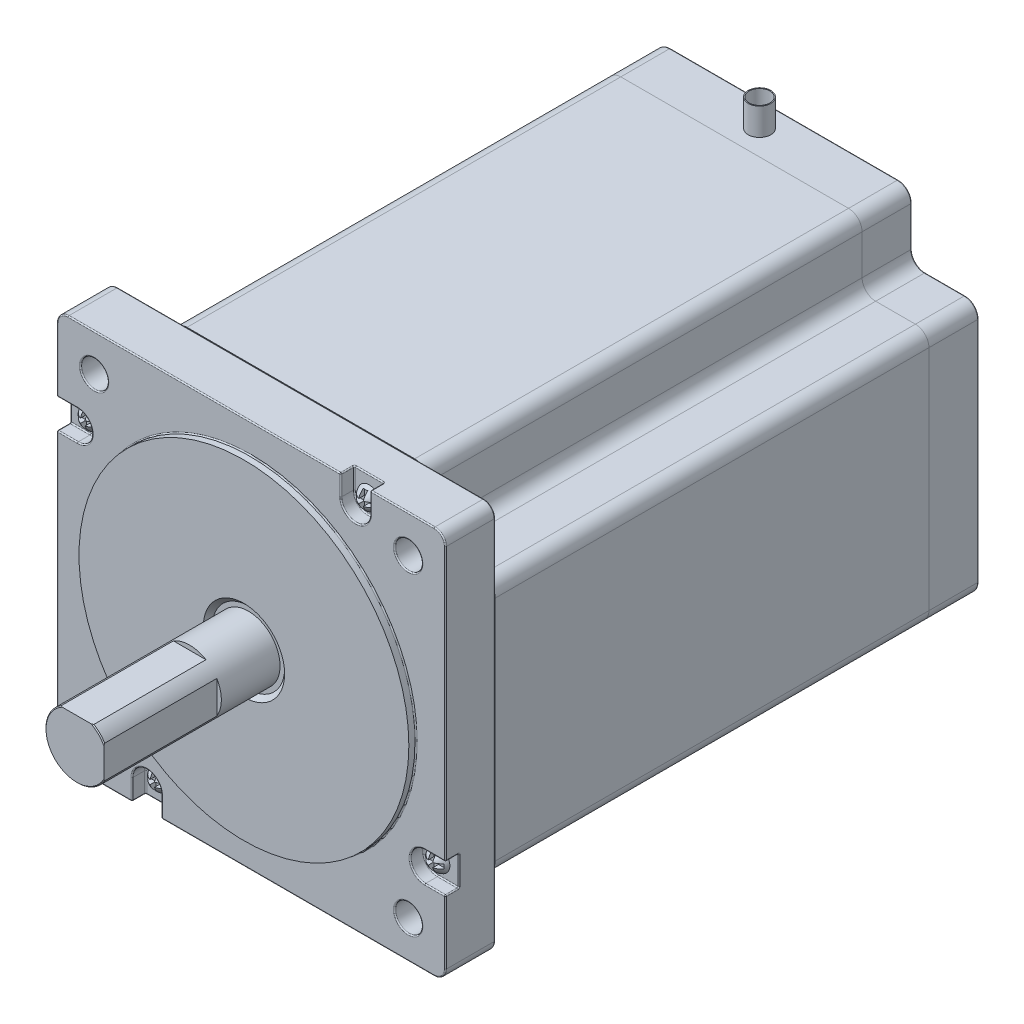
from build123d import *

# Parameters (mm, degrees)
SKETCH1_R                = 1.25
BOSS_EXTRUDE1_DEPTH      = 48
FILLET1_R                = 3
SKETCH2_R                = 1.25
BOSS_EXTRUDE2_DEPTH      = 11
SKETCH4_W                = 86
SKETCH4_H                = 86
SKETCH4_R                = 1.25
BOSS_EXTRUDE3_DEPTH      = 11
FILLET2_R                = 2.5
CUT_EXTRUDE1_DEPTH       = 3
SKETCH6_R                = 3
CUT_EXTRUDE2_DEPTH       = 11
SKETCH7_R                = 36.5
BOSS_EXTRUDE4_DEPTH      = 1.6
SKETCH8_R                = 8
CUT_EXTRUDE3_DEPTH       = 135.172128253
CHAMFER1_SIZE            = 1
CHAMFER2_SIZE            = 1
SKETCH9_R                = 8
SKETCH9_R_2              = 7
BOSS_EXTRUDE5_DEPTH      = 57.5
BOSS_EXTRUDE6_DEPTH      = 17.6
BOSS_EXTRUDE6_DEPTH_BACK = 124
SKETCH10_R               = 7
CHAMFER4_SIZE            = 0.2
CHAMFER5_SIZE            = 0.2
FILLET3_R                = 0.25
FILLET4_R                = 0.25
FILLET5_R                = 0.25
FILLET6_R                = 0.25
SKETCH18_R               = 2.5
SKETCH18_R_2             = 2.3
BOSS_EXTRUDE8_DEPTH      = 6
SKETCH24_W               = 24.354002436
SKETCH24_H               = 8.172852169
SKETCH24_W_2             = 4.223554476
SKETCH24_H_2             = 10.202352371
CUT_EXTRUDE4_DEPTH       = 25
CUT_EXTRUDE5_DEPTH       = 2.5
CIRPATTERN1_COUNT        = 4


with BuildPart() as part:
    # Sketch1 → Boss-Extrude1 (new, symmetric)
    with BuildSketch(Plane.XY):
        Polygon((-43, 28.2), (-28.2, 28.2), (-28.2, 43), (28.2, 43), (28.2, 28.2), (43, 28.2), (43, -28.2), (28.2, -28.2), (28.2, -43), (-28.2, -43), (-28.2, -28.2), (-43, -28.2), align=None)
        with Locations((-38.44, 23.1)):
            Circle(SKETCH1_R, mode=Mode.SUBTRACT)
        with Locations((23.1, 38.44)):
            Circle(SKETCH1_R, mode=Mode.SUBTRACT)
        with Locations((38.44, -23.1)):
            Circle(SKETCH1_R, mode=Mode.SUBTRACT)
        with Locations((-23.1, -38.44)):
            Circle(SKETCH1_R, mode=Mode.SUBTRACT)
    extrude(amount=BOSS_EXTRUDE1_DEPTH, both=True)

    # Fillet1
    fillet1_edges = [part.edges().sort_by_distance(p)[0] for p in [
        (-43, 28.2, 0),
        (-28.2, 28.2, 0),
        (-28.2, 43, 0),
        (28.2, 43, 0),
        (28.2, 28.2, 0),
        (43, 28.2, 0),
        (43, -28.2, 0),
        (28.2, -28.2, 0),
        (28.2, -43, 0),
        (-28.2, -43, 0),
        (-28.2, -28.2, 0),
        (-43, -28.2, 0),
    ]]
    fillet(fillet1_edges, radius=FILLET1_R)


with BuildPart() as body_2:
    # Sketch2 → Boss-Extrude2 (new body)
    with BuildSketch(Plane(origin=(0, 0, -48), x_dir=(-1, 0, 0), z_dir=(0, 0, -1))):
        with BuildLine():
            Line((-43, 25.2), (-43, -25.2))
            ThreePointArc((-43, -25.2), (-42.121320344, -27.321320344), (-40, -28.2))
            Line((-40, -28.2), (-31.2, -28.2))
            ThreePointArc((-31.2, -28.2), (-29.078679656, -29.078679656), (-28.2, -31.2))
            Line((-28.2, -31.2), (-28.2, -40))
            ThreePointArc((-28.2, -40), (-27.321320344, -42.121320344), (-25.2, -43))
            Line((-25.2, -43), (25.2, -43))
            ThreePointArc((25.2, -43), (27.321320344, -42.121320344), (28.2, -40))
            Line((28.2, -40), (28.2, -31.2))
            ThreePointArc((28.2, -31.2), (29.078679656, -29.078679656), (31.2, -28.2))
            Line((31.2, -28.2), (40, -28.2))
            ThreePointArc((40, -28.2), (42.121320344, -27.321320344), (43, -25.2))
            Line((43, -25.2), (43, 25.2))
            ThreePointArc((43, 25.2), (42.121320344, 27.321320344), (40, 28.2))
            Line((40, 28.2), (31.2, 28.2))
            ThreePointArc((31.2, 28.2), (29.078679656, 29.078679656), (28.2, 31.2))
            Line((28.2, 31.2), (28.2, 40))
            ThreePointArc((28.2, 40), (27.321320344, 42.121320344), (25.2, 43))
            Line((25.2, 43), (-25.2, 43))
            ThreePointArc((-25.2, 43), (-27.321320344, 42.121320344), (-28.2, 40))
            Line((-28.2, 40), (-28.2, 31.2))
            ThreePointArc((-28.2, 31.2), (-29.078679656, 29.078679656), (-31.2, 28.2))
            Line((-31.2, 28.2), (-40, 28.2))
            ThreePointArc((-40, 28.2), (-42.121320344, 27.321320344), (-43, 25.2))
        make_face()
        with Locations((38.44, 23.1)):
            Circle(SKETCH2_R, mode=Mode.SUBTRACT)
        with Locations((23.1, -38.44)):
            Circle(SKETCH2_R, mode=Mode.SUBTRACT)
        with Locations((-38.44, -23.1)):
            Circle(SKETCH2_R, mode=Mode.SUBTRACT)
        with Locations((-23.1, 38.44)):
            Circle(SKETCH2_R, mode=Mode.SUBTRACT)
    extrude(amount=BOSS_EXTRUDE2_DEPTH)


with BuildPart() as body_3:
    # Sketch4 → Boss-Extrude3 (new body)
    with BuildSketch(Plane.XY.offset(48)):
        Rectangle(SKETCH4_W, SKETCH4_H)
        with Locations((-23.1, -38.44)):
            Circle(SKETCH4_R, mode=Mode.SUBTRACT)
        with Locations((38.44, -23.1)):
            Circle(SKETCH4_R, mode=Mode.SUBTRACT)
        with Locations((23.1, 38.44)):
            Circle(SKETCH4_R, mode=Mode.SUBTRACT)
        with Locations((-38.44, 23.1)):
            Circle(SKETCH4_R, mode=Mode.SUBTRACT)
    extrude(amount=BOSS_EXTRUDE3_DEPTH)

    # Fillet2
    fillet2_edges = [body_3.edges().sort_by_distance(p)[0] for p in [
        (43, -43, 53.5),
        (-43, -43, 53.5),
        (-43, 43, 53.5),
        (43, 43, 53.5),
    ]]
    fillet(fillet2_edges, radius=FILLET2_R)

    # Sketch5 → Cut-Extrude1 (cut)
    with BuildSketch(Plane.XY.offset(59)):
        with BuildLine():
            Line((-38.44, 26.35), (-43, 26.35))
            Line((-43, 26.35), (-43, 19.85))
            Line((-43, 19.85), (-38.44, 19.85))
            ThreePointArc((-38.44, 19.85), (-35.19, 23.1), (-38.44, 26.35))
        make_face()
        with BuildLine():
            Line((26.35, 38.44), (26.35, 43))
            Line((26.35, 43), (19.85, 43))
            Line((19.85, 43), (19.85, 38.44))
            ThreePointArc((19.85, 38.44), (23.1, 35.19), (26.35, 38.44))
        make_face()
        with BuildLine():
            Line((38.44, -26.35), (43, -26.35))
            Line((43, -26.35), (43, -19.85))
            Line((43, -19.85), (38.44, -19.85))
            ThreePointArc((38.44, -19.85), (35.19, -23.1), (38.44, -26.35))
        make_face()
        with BuildLine():
            Line((-26.35, -38.44), (-26.35, -43))
            Line((-26.35, -43), (-19.85, -43))
            Line((-19.85, -43), (-19.85, -38.44))
            ThreePointArc((-19.85, -38.44), (-23.1, -35.19), (-26.35, -38.44))
        make_face()
    extrude(amount=-CUT_EXTRUDE1_DEPTH, mode=Mode.SUBTRACT)

    # Sketch6 → Cut-Extrude2 (cut)
    with BuildSketch(Plane.XY.offset(59)):
        with Locations((-34.75, 34.75)):
            Circle(SKETCH6_R)
        with Locations((34.75, 34.75)):
            Circle(SKETCH6_R)
        with Locations((34.75, -34.75)):
            Circle(SKETCH6_R)
        with Locations((-34.75, -34.75)):
            Circle(SKETCH6_R)
    extrude(amount=-CUT_EXTRUDE2_DEPTH, mode=Mode.SUBTRACT)

    # Sketch7 → Boss-Extrude4 (add)
    with BuildSketch(Plane.XY.offset(59)):
        Circle(SKETCH7_R)
    extrude(amount=BOSS_EXTRUDE4_DEPTH)


with BuildPart() as cut_extrude3_tool:
    # Sketch8 → Cut-Extrude3 (new, through all)
    with BuildSketch(Plane.XY.offset(60.6)):
        Circle(SKETCH8_R)
    extrude(amount=-CUT_EXTRUDE3_DEPTH)


with BuildPart() as part_1:
    add(part.part)

    # Cut-Extrude3: cut by cut_extrude3_tool
    add(cut_extrude3_tool.part, mode=Mode.SUBTRACT)


with BuildPart() as body_2_1:
    add(body_2.part)

    # Cut-Extrude3: cut by cut_extrude3_tool
    add(cut_extrude3_tool.part, mode=Mode.SUBTRACT)

    # Chamfer1
    chamfer1_edges = [body_2_1.edges().sort_by_distance(p)[0] for p in [
        (-8, 0, -59),
    ]]
    chamfer(chamfer1_edges, length=CHAMFER1_SIZE)

    # Fillet5
    fillet5_edges = [body_2_1.edges().sort_by_distance(p)[0] for p in [
        (42.121320344, -27.321320344, -59),
        (35.6, -28.2, -59),
        (29.078679656, -29.078679656, -59),
        (28.2, -35.6, -59),
        (27.321320344, -42.121320344, -59),
        (0, -43, -59),
        (-27.321320344, -42.121320344, -59),
        (-28.2, -35.6, -59),
        (-29.078679656, -29.078679656, -59),
        (-35.6, -28.2, -59),
        (42.121320344, 27.321320344, -59),
        (-42.121320344, -27.321320344, -59),
        (-43, 0, -59),
        (-42.121320344, 27.321320344, -59),
        (-35.6, 28.2, -59),
        (-29.078679656, 29.078679656, -59),
        (-28.2, 35.6, -59),
        (-37.19, 23.1, -59),
        (-27.321320344, 42.121320344, -59),
        (-21.85, -38.44, -59),
        (0, 43, -59),
        (39.69, -23.1, -59),
        (27.321320344, 42.121320344, -59),
        (28.2, 35.6, -59),
        (24.35, 38.44, -59),
        (43, 0, -59),
        (29.078679656, 29.078679656, -59),
        (35.6, 28.2, -59),
        (-9, 0, -59),
    ]]
    fillet(fillet5_edges, radius=FILLET5_R)


with BuildPart() as body_3_1:
    add(body_3.part)

    # Cut-Extrude3: cut by cut_extrude3_tool
    add(cut_extrude3_tool.part, mode=Mode.SUBTRACT)

    # Chamfer2
    chamfer2_edges = [body_3_1.edges().sort_by_distance(p)[0] for p in [
        (-8, 0, 60.6),
    ]]
    chamfer(chamfer2_edges, length=CHAMFER2_SIZE)

    # Fillet3
    fillet3_edges = [body_3_1.edges().sort_by_distance(p)[0] for p in [
        (-37.75, 34.75, 59),
        (31.75, 34.75, 59),
        (31.75, -34.75, 59),
        (-37.75, -34.75, 59),
        (-36.5, 0, 59),
        (-33.425, -43, 59),
        (-43, 33.425, 59),
        (43, -33.425, 59),
        (33.425, 43, 59),
        (-42.267766953, 42.267766953, 59),
        (42.267766953, 42.267766953, 59),
        (42.267766953, -42.267766953, 59),
        (-42.267766953, -42.267766953, 59),
        (-43, -10.325, 59),
        (-35.19, 23.1, 59),
        (-40.72, 26.35, 59),
        (-40.72, 19.85, 59),
        (10.325, -43, 59),
        (-10.325, 43, 59),
        (43, 10.325, 59),
        (23.1, 35.19, 59),
        (26.35, 40.72, 59),
        (19.85, 40.72, 59),
        (35.19, -23.1, 59),
        (40.72, -26.35, 59),
        (40.72, -19.85, 59),
        (-23.1, -35.19, 59),
        (-26.35, -40.72, 59),
        (-19.85, -40.72, 59),
    ]]
    fillet(fillet3_edges, radius=FILLET3_R)

    # Fillet4
    # the kernel refuses this fillet: 0.25 mm, written as the material it adds along each edge
    with BuildSketch(Plane(origin=(-38.44, 23.1, 56), x_dir=(0, -1, 0), z_dir=(-1, 0, 0))) as fillet4_piece_1:
        with BuildLine():
            CenterArc((3.25 - FILLET4_R, FILLET4_R), FILLET4_R, 270, 90)
            Line((3.25, FILLET4_R), (3.25, 0))
            Line((3.25, 0), (3.25 - FILLET4_R, 0))
        make_face()
    revolve(axis=Axis((-38.44, 23.1, 56), (0, 0, 1)), revolution_arc=180)
    with BuildSketch(Plane(origin=(-43, 19.85, 56), x_dir=(0, 1, 0), z_dir=(1, 0, 0)), Plane(origin=(19.85, 43, 56), x_dir=(1, 0, 0), z_dir=(0, -1, 0)), Plane(origin=(43, -19.85, 56), x_dir=(0, -1, 0), z_dir=(-1, 0, 0)), Plane(origin=(-19.85, -43, 56), x_dir=(-1, 0, 0), z_dir=(0, 1, 0))) as fillet4_piece_2:
        with BuildLine():
            CenterArc((FILLET4_R, FILLET4_R), FILLET4_R, 180, 90)
            Line((0, FILLET4_R), (0, 0))
            Line((0, 0), (FILLET4_R, 0))
        make_face()
    extrude(amount=4.56)
    with BuildSketch(Plane(origin=(-38.44, 26.35, 56), x_dir=(0, 0, 1), z_dir=(-1, 0, 0)), Plane(origin=(26.35, 38.44, 56), x_dir=(0, 0, 1), z_dir=(0, 1, 0)), Plane(origin=(38.44, -26.35, 56), x_dir=(0, 0, 1), z_dir=(1, 0, 0)), Plane(origin=(-26.35, -38.44, 56), x_dir=(0, 0, 1), z_dir=(0, -1, 0))) as fillet4_piece_3:
        with BuildLine():
            CenterArc((FILLET4_R, -FILLET4_R), FILLET4_R, 90, 90)
            Line((0, -FILLET4_R), (0, 0))
            Line((0, 0), (FILLET4_R, 0))
        make_face()
    extrude(amount=4.56)
    with BuildSketch(Plane(origin=(23.1, 38.44, 56), x_dir=(-1, 0, 0), z_dir=(0, 1, 0))) as fillet4_piece_4:
        with BuildLine():
            CenterArc((3.25 - FILLET4_R, FILLET4_R), FILLET4_R, 270, 90)
            Line((3.25, FILLET4_R), (3.25, 0))
            Line((3.25, 0), (3.25 - FILLET4_R, 0))
        make_face()
    revolve(axis=Axis((23.1, 38.44, 56), (0, 0, 1)), revolution_arc=180)
    with BuildSketch(Plane(origin=(38.44, -23.1, 56), x_dir=(0, 1, 0), z_dir=(1, 0, 0))) as fillet4_piece_5:
        with BuildLine():
            CenterArc((3.25 - FILLET4_R, FILLET4_R), FILLET4_R, 270, 90)
            Line((3.25, FILLET4_R), (3.25, 0))
            Line((3.25, 0), (3.25 - FILLET4_R, 0))
        make_face()
    revolve(axis=Axis((38.44, -23.1, 56), (0, 0, 1)), revolution_arc=180)
    with BuildSketch(Plane(origin=(-23.1, -38.44, 56), x_dir=(1, 0, 0), z_dir=(0, -1, 0))) as fillet4_piece_6:
        with BuildLine():
            CenterArc((3.25 - FILLET4_R, FILLET4_R), FILLET4_R, 270, 90)
            Line((3.25, FILLET4_R), (3.25, 0))
            Line((3.25, 0), (3.25 - FILLET4_R, 0))
        make_face()
    revolve(axis=Axis((-23.1, -38.44, 56), (0, 0, 1)), revolution_arc=180)
    # the kernel refuses this fillet: 0.25 mm, written as the material it takes off along each edge
    with BuildSketch(Plane(origin=(-38.44, 23.1, 56), x_dir=(1, 0, 0), z_dir=(0, 1, 0))) as fillet4_2_piece_1:
        with BuildLine():
            CenterArc((1.25 + FILLET4_R, FILLET4_R), FILLET4_R, 180, 90)
            Line((1.25 + FILLET4_R, 0), (1.25, 0))
            Line((1.25, 0), (1.25, FILLET4_R))
        make_face()
    revolve(axis=Axis((-38.44, 23.1, 56), (0, 0, -1)), mode=Mode.SUBTRACT)
    with BuildSketch(Plane(origin=(23.1, 38.44, 56), x_dir=(1, 0, 0), z_dir=(0, 1, 0))) as fillet4_2_piece_2:
        with BuildLine():
            CenterArc((1.25 + FILLET4_R, FILLET4_R), FILLET4_R, 180, 90)
            Line((1.25, FILLET4_R), (1.25, 0))
            Line((1.25, 0), (1.25 + FILLET4_R, 0))
        make_face()
    revolve(axis=Axis((23.1, 38.44, 56), (0, 0, -1)), mode=Mode.SUBTRACT)
    with BuildSketch(Plane(origin=(38.44, -23.1, 56), x_dir=(1, 0, 0), z_dir=(0, 1, 0))) as fillet4_2_piece_3:
        with BuildLine():
            CenterArc((1.25 + FILLET4_R, FILLET4_R), FILLET4_R, 180, 90)
            Line((1.25 + FILLET4_R, 0), (1.25, 0))
            Line((1.25, 0), (1.25, FILLET4_R))
        make_face()
    revolve(axis=Axis((38.44, -23.1, 56), (0, 0, -1)), mode=Mode.SUBTRACT)
    # the kernel refuses this fillet: 0.25 mm, written as the material it takes off along each edge
    with BuildSketch(Plane(origin=(-26.6, -42.75, 58.75), x_dir=(1, 0, 0), z_dir=(0, -1, 0))) as fillet4_3_piece_1_section:
        Polygon((0, 0), (FILLET4_R, 0), (FILLET4_R, FILLET4_R), (0, FILLET4_R), align=None)
    fillet4_3_piece_1 = extrude(amount=FILLET4_R, mode=Mode.PRIVATE)
    fillet4_3_piece_1 = fillet4_3_piece_1 - Plane(origin=(-26.6, -42.75, 58.75), x_dir=(-0.7071067811865475, 0, -0.7071067811865475), z_dir=(0, -1, 0)) * Sphere(FILLET4_R, mode=Mode.PRIVATE)
    add(fillet4_3_piece_1, mode=Mode.SUBTRACT)
    with BuildSketch(Plane(origin=(-19.6, -42.75, 58.75), x_dir=(-1, 0, 0), z_dir=(0, -1, 0))) as fillet4_3_piece_2_section:
        Polygon((0, 0), (FILLET4_R, 0), (FILLET4_R, -FILLET4_R), (0, -FILLET4_R), align=None)
    fillet4_3_piece_2 = extrude(amount=FILLET4_R, mode=Mode.PRIVATE)
    fillet4_3_piece_2 = fillet4_3_piece_2 - Plane(origin=(-19.6, -42.75, 58.75), x_dir=(0.7071067811865475, 0, -0.7071067811865475), z_dir=(0, -1, 0)) * Sphere(FILLET4_R, mode=Mode.PRIVATE)
    add(fillet4_3_piece_2, mode=Mode.SUBTRACT)
    with BuildSketch(Plane(origin=(-42.75, 19.6, 58.75), x_dir=(0, 1, 0), z_dir=(-1, 0, 0))) as fillet4_3_piece_3_section:
        Polygon((0, 0), (FILLET4_R, 0), (FILLET4_R, -FILLET4_R), (0, -FILLET4_R), align=None)
    fillet4_3_piece_3 = extrude(amount=FILLET4_R, mode=Mode.PRIVATE)
    fillet4_3_piece_3 = fillet4_3_piece_3 - Plane(origin=(-42.75, 19.6, 58.75), x_dir=(0, -0.7071067811865475, -0.7071067811865475), z_dir=(-1, 0, 0)) * Sphere(FILLET4_R, mode=Mode.PRIVATE)
    add(fillet4_3_piece_3, mode=Mode.SUBTRACT)
    with BuildSketch(Plane(origin=(42.75, -26.6, 58.75), x_dir=(0, 1, 0), z_dir=(1, 0, 0))) as fillet4_3_piece_4_section:
        Polygon((0, 0), (FILLET4_R, 0), (FILLET4_R, FILLET4_R), (0, FILLET4_R), align=None)
    fillet4_3_piece_4 = extrude(amount=FILLET4_R, mode=Mode.PRIVATE)
    fillet4_3_piece_4 = fillet4_3_piece_4 - Plane(origin=(42.75, -26.6, 58.75), x_dir=(-1.1018192692517713e-15, -0.7071067811865475, -0.7071067811865475), z_dir=(1, 0, 0)) * Sphere(FILLET4_R, mode=Mode.PRIVATE)
    add(fillet4_3_piece_4, mode=Mode.SUBTRACT)
    with BuildSketch(Plane(origin=(-42.75, 26.6, 58.75), x_dir=(0, -1, 0), z_dir=(-1, 0, 0))) as fillet4_3_piece_5_section:
        Polygon((0, 0), (FILLET4_R, 0), (FILLET4_R, FILLET4_R), (0, FILLET4_R), align=None)
    fillet4_3_piece_5 = extrude(amount=FILLET4_R, mode=Mode.PRIVATE)
    fillet4_3_piece_5 = fillet4_3_piece_5 - Plane(origin=(-42.75, 26.6, 58.75), x_dir=(1.1018192692517713e-15, 0.7071067811865475, -0.7071067811865475), z_dir=(-1, 0, 0)) * Sphere(FILLET4_R, mode=Mode.PRIVATE)
    add(fillet4_3_piece_5, mode=Mode.SUBTRACT)
    with BuildSketch(Plane(origin=(42.75, -19.6, 58.75), x_dir=(0, -1, 0), z_dir=(1, 0, 0))) as fillet4_3_piece_6_section:
        Polygon((0, 0), (FILLET4_R, 0), (FILLET4_R, -FILLET4_R), (0, -FILLET4_R), align=None)
    fillet4_3_piece_6 = extrude(amount=FILLET4_R, mode=Mode.PRIVATE)
    fillet4_3_piece_6 = fillet4_3_piece_6 - Plane(origin=(42.75, -19.6, 58.75), x_dir=(1.1018192692517713e-15, 0.7071067811865475, -0.7071067811865475), z_dir=(1, 0, 0)) * Sphere(FILLET4_R, mode=Mode.PRIVATE)
    add(fillet4_3_piece_6, mode=Mode.SUBTRACT)
    with BuildSketch(Plane(origin=(19.6, 42.75, 58.75), x_dir=(1, 0, 0), z_dir=(0, 1, 0))) as fillet4_3_piece_7_section:
        Polygon((0, 0), (FILLET4_R, 0), (FILLET4_R, -FILLET4_R), (0, -FILLET4_R), align=None)
    fillet4_3_piece_7 = extrude(amount=FILLET4_R, mode=Mode.PRIVATE)
    fillet4_3_piece_7 = fillet4_3_piece_7 - Plane(origin=(19.6, 42.75, 58.75), x_dir=(-0.7071067811865475, 1.1018192692517713e-15, -0.7071067811865475), z_dir=(0, 1, 0)) * Sphere(FILLET4_R, mode=Mode.PRIVATE)
    add(fillet4_3_piece_7, mode=Mode.SUBTRACT)
    with BuildSketch(Plane(origin=(26.6, 42.75, 58.75), x_dir=(-1, 0, 0), z_dir=(0, 1, 0))) as fillet4_3_piece_8_section:
        Polygon((0, 0), (FILLET4_R, 0), (FILLET4_R, FILLET4_R), (0, FILLET4_R), align=None)
    fillet4_3_piece_8 = extrude(amount=FILLET4_R, mode=Mode.PRIVATE)
    fillet4_3_piece_8 = fillet4_3_piece_8 - Plane(origin=(26.6, 42.75, 58.75), x_dir=(0.7071067811865475, -1.1018192692517713e-15, -0.7071067811865475), z_dir=(0, 1, 0)) * Sphere(FILLET4_R, mode=Mode.PRIVATE)
    add(fillet4_3_piece_8, mode=Mode.SUBTRACT)
    with BuildSketch(Plane(origin=(-43, 26.1, 56), x_dir=(0, 0, -1), z_dir=(0, -1, 0)), Plane(origin=(26.1, 43, 56), x_dir=(0, 0, -1), z_dir=(-1, 0, 0)), Plane(origin=(43, -26.1, 56), x_dir=(0, 0, -1), z_dir=(0, 1, 0)), Plane(origin=(-26.1, -43, 56), x_dir=(0, 0, -1), z_dir=(1, 0, 0))) as fillet4_3_piece_9:
        with BuildLine():
            CenterArc((FILLET4_R, FILLET4_R), FILLET4_R, 180, 90)
            Line((0, FILLET4_R), (0, 0))
            Line((0, 0), (FILLET4_R, 0))
        make_face()
    extrude(amount=6, mode=Mode.SUBTRACT)
    with BuildSketch(Plane(origin=(-43, 19.85, 58.75), x_dir=(0, -1, 0), z_dir=(0, 0, -1)), Plane(origin=(19.85, 43, 58.75), x_dir=(-1, 0, 0), z_dir=(0, 0, -1)), Plane(origin=(43, -19.85, 58.75), x_dir=(0, 1, 0), z_dir=(0, 0, -1)), Plane(origin=(-19.85, -43, 58.75), x_dir=(1, 0, 0), z_dir=(0, 0, -1))) as fillet4_3_piece_10:
        with BuildLine():
            CenterArc((FILLET4_R, -FILLET4_R), FILLET4_R, 90, 90)
            Line((0, -FILLET4_R), (0, 0))
            Line((0, 0), (FILLET4_R, 0))
        make_face()
    extrude(amount=2.5, mode=Mode.SUBTRACT)
    with BuildSketch(Plane(origin=(-43, 26.35, 58.75), x_dir=(0, 1, 0), z_dir=(0, 0, -1)), Plane(origin=(26.35, 43, 58.75), x_dir=(1, 0, 0), z_dir=(0, 0, -1)), Plane(origin=(43, -26.35, 58.75), x_dir=(0, -1, 0), z_dir=(0, 0, -1)), Plane(origin=(-26.35, -43, 58.75), x_dir=(-1, 0, 0), z_dir=(0, 0, -1))) as fillet4_3_piece_11:
        with BuildLine():
            CenterArc((FILLET4_R, FILLET4_R), FILLET4_R, 180, 90)
            Line((0, FILLET4_R), (0, 0))
            Line((0, 0), (FILLET4_R, 0))
        make_face()
    extrude(amount=2.5, mode=Mode.SUBTRACT)
    with BuildSketch(Plane(origin=(-26.1, -43, 56.25), x_dir=(-1, 0, 0), z_dir=(0, 0, 1))) as fillet4_3_piece_12:
        with BuildLine():
            CenterArc((0.25 + FILLET4_R, -FILLET4_R), FILLET4_R, 90, 90)
            Line((0.25, -FILLET4_R), (0.25, 0))
            Line((0.25, 0), (0.25 + FILLET4_R, 0))
        make_face()
    revolve(axis=Axis((-26.1, -43, 56.25), (0, -1, 0)), revolution_arc=90, mode=Mode.SUBTRACT)
    with BuildSketch(Plane(origin=(-20.1, -43, 56.25), x_dir=(0, 0, -1), z_dir=(-1, 0, 0))) as fillet4_3_piece_13:
        with BuildLine():
            CenterArc((0.25 + FILLET4_R, -FILLET4_R), FILLET4_R, 90, 90)
            Line((0.25, -FILLET4_R), (0.25, 0))
            Line((0.25, 0), (0.25 + FILLET4_R, 0))
        make_face()
    revolve(axis=Axis((-20.1, -43, 56.25), (0, -1, 0)), revolution_arc=90, mode=Mode.SUBTRACT)
    with BuildSketch(Plane(origin=(43, -26.1, 56.25), x_dir=(0, -1, 0), z_dir=(0, 0, 1))) as fillet4_3_piece_14:
        with BuildLine():
            CenterArc((0.25 + FILLET4_R, -FILLET4_R), FILLET4_R, 90, 90)
            Line((0.25, -FILLET4_R), (0.25, 0))
            Line((0.25, 0), (0.25 + FILLET4_R, 0))
        make_face()
    revolve(axis=Axis((43, -26.1, 56.25), (1, 0, 0)), revolution_arc=90, mode=Mode.SUBTRACT)
    with BuildSketch(Plane(origin=(43, -20.1, 56.25), x_dir=(0, 0, -1), z_dir=(0, -1, 0))) as fillet4_3_piece_15:
        with BuildLine():
            CenterArc((0.25 + FILLET4_R, -FILLET4_R), FILLET4_R, 90, 90)
            Line((0.25, -FILLET4_R), (0.25, 0))
            Line((0.25, 0), (0.25 + FILLET4_R, 0))
        make_face()
    revolve(axis=Axis((43, -20.1, 56.25), (1, 0, 0)), revolution_arc=90, mode=Mode.SUBTRACT)
    with BuildSketch(Plane(origin=(26.1, 43, 56.25), x_dir=(1, 0, 0), z_dir=(0, 0, 1))) as fillet4_3_piece_16:
        with BuildLine():
            CenterArc((0.25 + FILLET4_R, -FILLET4_R), FILLET4_R, 90, 90)
            Line((0.25, -FILLET4_R), (0.25, 0))
            Line((0.25, 0), (0.25 + FILLET4_R, 0))
        make_face()
    revolve(axis=Axis((26.1, 43, 56.25), (0, 1, 0)), revolution_arc=90, mode=Mode.SUBTRACT)
    with BuildSketch(Plane(origin=(20.1, 43, 56.25), x_dir=(0, 0, -1), z_dir=(1, 0, 0))) as fillet4_3_piece_17:
        with BuildLine():
            CenterArc((0.25 + FILLET4_R, -FILLET4_R), FILLET4_R, 90, 90)
            Line((0.25, -FILLET4_R), (0.25, 0))
            Line((0.25, 0), (0.25 + FILLET4_R, 0))
        make_face()
    revolve(axis=Axis((20.1, 43, 56.25), (0, 1, 0)), revolution_arc=90, mode=Mode.SUBTRACT)
    with BuildSketch(Plane(origin=(-43, 26.1, 56.25), x_dir=(0, 1, 0), z_dir=(0, 0, 1))) as fillet4_3_piece_18:
        with BuildLine():
            CenterArc((0.25 + FILLET4_R, -FILLET4_R), FILLET4_R, 90, 90)
            Line((0.25, -FILLET4_R), (0.25, 0))
            Line((0.25, 0), (0.25 + FILLET4_R, 0))
        make_face()
    revolve(axis=Axis((-43, 26.1, 56.25), (-1, 0, 0)), revolution_arc=90, mode=Mode.SUBTRACT)
    with BuildSketch(Plane(origin=(-43, 20.1, 56.25), x_dir=(0, 0, -1), z_dir=(0, 1, 0))) as fillet4_3_piece_19:
        with BuildLine():
            CenterArc((0.25 + FILLET4_R, -FILLET4_R), FILLET4_R, 90, 90)
            Line((0.25, -FILLET4_R), (0.25, 0))
            Line((0.25, 0), (0.25 + FILLET4_R, 0))
        make_face()
    revolve(axis=Axis((-43, 20.1, 56.25), (-1, 0, 0)), revolution_arc=90, mode=Mode.SUBTRACT)

    # Fillet6
    fillet6_edges = [body_3_1.edges().sort_by_distance(p)[0] for p in [
        (-24.35, -38.44, 48),
        (-37.75, 34.75, 48),
        (31.75, 34.75, 48),
        (31.75, -34.75, 48),
        (-37.75, -34.75, 48),
        (-8, 0, 48),
        (37.19, -23.1, 48),
        (21.85, 38.44, 48),
        (-39.69, 23.1, 48),
        (0, -43, 48),
        (43, 0, 48),
        (-43, 0, 48),
        (0, 43, 48),
        (-42.267766953, 42.267766953, 48),
        (42.267766953, 42.267766953, 48),
        (42.267766953, -42.267766953, 48),
        (-42.267766953, -42.267766953, 48),
    ]]
    fillet(fillet6_edges, radius=FILLET6_R)

    # Sketch11 → Revolve1 (revolve)
    with BuildSketch(Plane.ZY.offset(38.47)):
        with BuildLine():
            Line((58, 23.1), (56, 23.1))
            Line((56, 23.1), (56, 25.6))
            ThreePointArc((56, 25.6), (57.322549983, 24.608039986), (58, 23.1))
        make_face()
    revolve1 = revolve(axis=Axis((-38.47, 23.1, 59), (0, 0, -1)))

    # Sketch25 → Cut-Extrude5 (cut)
    with BuildSketch(Plane.XY.offset(59)):
        Polygon((-37.97, 22.6), (-37.97, 21.1), (-38.97, 21.1), (-38.97, 22.6), (-40.47, 22.6), (-40.47, 23.6), (-38.97, 23.6), (-38.97, 25.1), (-37.97, 25.1), (-37.97, 23.6), (-36.47, 23.6), (-36.47, 22.6), align=None)
    cut_extrude5 = extrude(amount=-CUT_EXTRUDE5_DEPTH, mode=Mode.SUBTRACT)

    # CirPattern1: Revolve1, Cut-Extrude5 ×4 about axis
    cirpattern1_axis = Axis((0, 0, 0), (0, 0, 1))
    add([revolve1.rotate(cirpattern1_axis, i * 360 / CIRPATTERN1_COUNT) for i in range(1, CIRPATTERN1_COUNT)])
    add([cut_extrude5.rotate(cirpattern1_axis, i * 360 / CIRPATTERN1_COUNT) for i in range(1, CIRPATTERN1_COUNT)], mode=Mode.SUBTRACT)


with BuildPart() as body_4:
    # Sketch9 → Boss-Extrude5 (new body)
    with BuildSketch(Plane.XY.offset(59.6)):
        Circle(SKETCH9_R)
        Circle(SKETCH9_R_2, mode=Mode.SUBTRACT)
    extrude(amount=-BOSS_EXTRUDE5_DEPTH)


with BuildPart() as body_5:
    # Sketch10 → Boss-Extrude6 (new, two sides: drawn at the far end of the back side and taken through both)
    with BuildSketch(Plane.XY.offset(80).offset(-BOSS_EXTRUDE6_DEPTH_BACK)):
        with Locations(Location((0, 0, 0), (0, 0, 180))):
            Circle(SKETCH10_R)
    extrude(amount=BOSS_EXTRUDE6_DEPTH + BOSS_EXTRUDE6_DEPTH_BACK)

    # Chamfer4
    chamfer4_edges = [body_5.edges().sort_by_distance(p)[0] for p in [
        (7, 0, 97.6),
    ]]
    chamfer(chamfer4_edges, length=CHAMFER4_SIZE)

    # Chamfer5
    chamfer5_edges = [body_5.edges().sort_by_distance(p)[0] for p in [
        (7, 0, -44),
    ]]
    chamfer(chamfer5_edges, length=CHAMFER5_SIZE)

    # Sketch24 → Cut-Extrude4 (cut)
    with BuildSketch(Plane.XY.offset(97.6)):
        with Locations((-1.355780101, 10.086426085)):
            Rectangle(SKETCH24_W, SKETCH24_H)
        with Locations((8.111777238, -0.445768946)):
            Rectangle(SKETCH24_W_2, SKETCH24_H_2)
    extrude(amount=-CUT_EXTRUDE4_DEPTH, mode=Mode.SUBTRACT)


with BuildPart() as body_6:
    # Sketch18 → Boss-Extrude8 (new body)
    with BuildSketch(Plane(origin=(0, 43, 0), x_dir=(1, 0, 0), z_dir=(0, 1, 0))):
        with Locations(Location((0, 53.5, 0), (0, 0, 180))):
            Circle(SKETCH18_R)
        with Locations(Location((0, 53.5, 0), (0, 0, 180))):
            Circle(SKETCH18_R_2, mode=Mode.SUBTRACT)
    extrude(amount=BOSS_EXTRUDE8_DEPTH)


solid = Compound([part_1.part, body_2_1.part, body_3_1.part, body_4.part, body_5.part, body_6.part])
